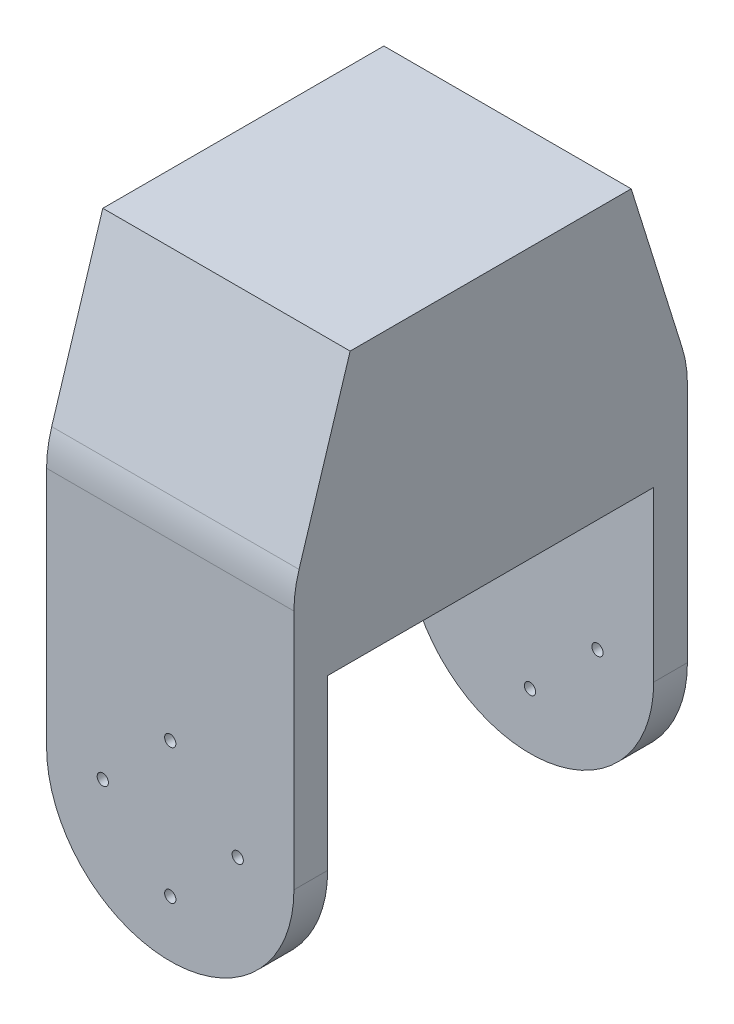
from build123d import *

# Parameters (mm, degrees)
BOSS_EXTRUDE1_DEPTH = 3
SKETCH2_W           = 22
SKETCH2_H           = 4
BOSS_EXTRUDE2_DEPTH = 29
BOSS_EXTRUDE3_START = 3
BOSS_EXTRUDE3_DEPTH = 3
SKETCH5_R           = 0.5
CUT_EXTRUDE1_DEPTH  = 42.31585652
BOSS_EXTRUDE4_DEPTH = 11
FILLET1_R           = 10


with BuildPart() as part:
    # Sketch1 → Boss-Extrude1 (new body)
    with BuildSketch(Plane.XY):
        with BuildLine():
            Line((-11, 0), (-11, 19))
            Line((-11, 19), (11, 19))
            Line((11, 19), (11, 0))
            ThreePointArc((11, 0), (0, -11), (-11, 0))
        make_face()
    extrude(amount=BOSS_EXTRUDE1_DEPTH)

    # Sketch2 → Boss-Extrude2 (add)
    with BuildSketch(Plane(origin=(0, 0, 0), x_dir=(-1, 0, 0), z_dir=(0, 0, -1))):
        with Locations((0, 17)):
            Rectangle(SKETCH2_W, SKETCH2_H)
    extrude(amount=BOSS_EXTRUDE2_DEPTH)

    # Sketch4 → Boss-Extrude3 (add)
    with BuildSketch(Plane(origin=(0, 0, -29), x_dir=(-1, 0, 0), z_dir=(0, 0, -1)).offset(BOSS_EXTRUDE3_START)):
        with BuildLine():
            Line((-11, 19), (11, 19))
            Line((11, 19), (11, 0))
            ThreePointArc((11, 0), (0, -11), (-11, 0))
            Line((-11, 0), (-11, 19))
        make_face()
    extrude(amount=-BOSS_EXTRUDE3_DEPTH)

    # Sketch5 → Cut-Extrude1 (cut, through all)
    with BuildSketch(Plane.XY.offset(3)):
        with Locations((0, 6)):
            Circle(SKETCH5_R)
        with Locations((-6, 0)):
            Circle(SKETCH5_R)
        with Locations((0, -6)):
            Circle(SKETCH5_R)
        with Locations((6, 0)):
            Circle(SKETCH5_R)
    extrude(amount=-CUT_EXTRUDE1_DEPTH, mode=Mode.SUBTRACT)

    # Sketch6 → Boss-Extrude4 (add, symmetric)
    with BuildSketch(Plane.ZY):
        Polygon((-32, 19), (3, 19), (3, 23), (-2, 39), (-27, 39), (-32, 23), align=None)
    extrude(amount=BOSS_EXTRUDE4_DEPTH, both=True)

    # Fillet1
    fillet1_edges = [part.edges().sort_by_distance(p)[0] for p in [
        (0, 23, 3),
        (0, 23, -32),
    ]]
    fillet(fillet1_edges, radius=FILLET1_R)


solid = part.part
